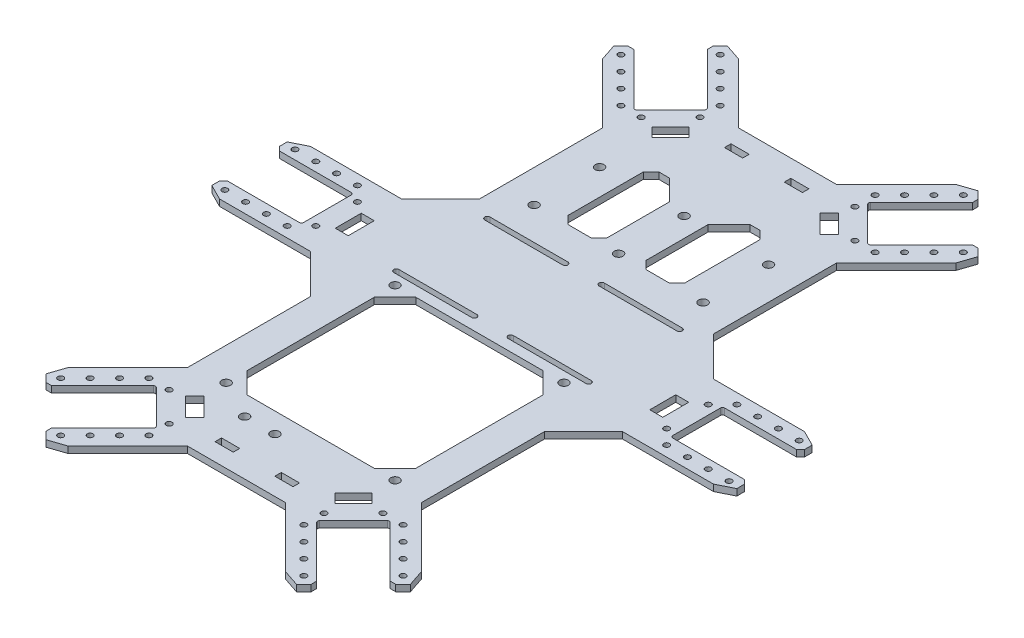
from build123d import *
from OCP.BRepFilletAPI import BRepFilletAPI_MakeChamfer

# Parameters (mm, degrees)
BOSS_EXTRU_1_DEPTH       = 2.5
ENL_V_MAT_EXTRU_1_REACH  = 191.513
ESQUISSE2_W              = 24.5
ESQUISSE2_H              = 20
ESQUISSE2_W_2            = 5.5
D_GAGEMENT_M21_D         = 2.2
SYM_TRIE4_OUTLINE_R      = 1.1
SYM_TRIE4_DEPTH          = 2.5
CHANFREIN1_SIZE          = 15
CHANFREIN3_SIZE          = 1.5
CHANFREIN4_SIZE          = 6
CHANFREIN4_SIZE2         = 3
CHANFREIN5_SIZE          = 3
CHANFREIN5_SIZE2         = 6
SYM_TRIE5_DEPTH          = 2.5
SYM_TRIE6_DEPTH          = 2.5
CONG_1_R                 = 0.8
ENL_V_MAT_EXTRU_2_REACH  = 167.515
ESQUISSE5_W              = 5
ESQUISSE5_H              = 10
ESQUISSE5_W_2            = 7
ESQUISSE5_H_2            = 2.5
M3_CLEARANCE_HOLE1_D     = 3.4
M3_CLEARANCE_HOLE1_DEPTH = 2.5
ENL_V_MAT_EXTRU_3_REACH  = 167.515


# Read off the part's stored shape, not the designer's step: Symétrie4, Symétrie5, Symétrie6
with BuildPart() as part:
    # Esquisse1 → Boss.-Extru.1 (new body)
    with BuildSketch(Plane(origin=(0, 0, 0), x_dir=(1, 0, 0), z_dir=(0, 1, 0))):
        Polygon((18.837049096, 106), (-18.837049096, 106), (-59.495863992, 146.658814896), (-85.658814896, 120.495863992), (-45, 79.837049096), (-45, 17.5), (-120, 17.5), (-120, -17.5), (-45, -17.5), (-45, -79.837049096), (-85.658814896, -120.495863992), (-59.495863992, -146.658814896), (-18.837049096, -106), (18.837049096, -106), (59.495863992, -146.658814896), (85.658814896, -120.495863992), (45, -79.837049096), (45, -17.5), (120, -17.5), (120, 17.5), (45, 17.5), (45, 79.837049096), (85.658814896, 120.495863992), (59.495863992, 146.658814896), align=None)
    extrude(amount=BOSS_EXTRU_1_DEPTH)

    # Esquisse2 → Enlèv. mat.-Extru.1 (cut, up to next)
    with BuildSketch(Plane(origin=(0, 2.5, 0), x_dir=(1, 0, 0), z_dir=(0, 1, 0)), mode=Mode.PRIVATE) as enl_v_mat_extru_1_sk1:
        Polygon((-48.182155493, 123.324291117), (-62.324291117, 109.182155493), (-45.000174977, 91.858039354), (-30.858039354, 106.000174977), align=None)
    enl_v_mat_extru_1_tool1 = extrude(enl_v_mat_extru_1_sk1.sketch, amount=-ENL_V_MAT_EXTRU_1_REACH, mode=Mode.PRIVATE) & part.part
    # Esquisse2 → Enlèv. mat.-Extru.1 (cut, up to next)
    with BuildSketch(Plane(origin=(0, 2.5, 0), x_dir=(1, 0, 0), z_dir=(0, 1, 0)), mode=Mode.PRIVATE) as enl_v_mat_extru_1_sk2:
        Polygon((-52.071242789, 127.213378413), (-66.213378413, 113.071242789), (-62.324291117, 109.182155493), (-48.182155493, 123.324291117), align=None)
    enl_v_mat_extru_1_tool2 = extrude(enl_v_mat_extru_1_sk2.sketch, amount=-ENL_V_MAT_EXTRU_1_REACH, mode=Mode.PRIVATE) & part.part
    # Esquisse2 → Enlèv. mat.-Extru.1 (cut, up to next)
    with BuildSketch(Plane(origin=(0, 2.5, 0), x_dir=(1, 0, 0), z_dir=(0, 1, 0)), mode=Mode.PRIVATE) as enl_v_mat_extru_1_sk3:
        Polygon((-52.071242789, 127.213378413), (-66.213378413, 113.071242789), (-62.324291117, 109.182155493), (-48.182155493, 123.324291117), align=None)
    enl_v_mat_extru_1_tool3 = extrude(enl_v_mat_extru_1_sk3.sketch, amount=-ENL_V_MAT_EXTRU_1_REACH, mode=Mode.PRIVATE) & part.part
    # Esquisse2 → Enlèv. mat.-Extru.1 (cut, up to next)
    with BuildSketch(Plane(origin=(0, 2.5, 0), x_dir=(1, 0, 0), z_dir=(0, 1, 0)), mode=Mode.PRIVATE) as enl_v_mat_extru_1_sk4:
        with Locations((-83.25, 0)):
            Rectangle(ESQUISSE2_W, ESQUISSE2_H)
    enl_v_mat_extru_1_tool4 = extrude(enl_v_mat_extru_1_sk4.sketch, amount=-ENL_V_MAT_EXTRU_1_REACH, mode=Mode.PRIVATE) & part.part
    # Esquisse2 → Enlèv. mat.-Extru.1 (cut, up to next)
    with BuildSketch(Plane(origin=(0, 2.5, 0), x_dir=(1, 0, 0), z_dir=(0, 1, 0)), mode=Mode.PRIVATE) as enl_v_mat_extru_1_sk5:
        with Locations((-98.25, 0)):
            Rectangle(ESQUISSE2_W_2, ESQUISSE2_H)
    enl_v_mat_extru_1_tool5 = extrude(enl_v_mat_extru_1_sk5.sketch, amount=-ENL_V_MAT_EXTRU_1_REACH, mode=Mode.PRIVATE) & part.part
    # Esquisse2 → Enlèv. mat.-Extru.1 (cut, up to next)
    with BuildSketch(Plane(origin=(0, 2.5, 0), x_dir=(1, 0, 0), z_dir=(0, 1, 0)), mode=Mode.PRIVATE) as enl_v_mat_extru_1_sk6:
        with Locations((-98.25, 0)):
            Rectangle(ESQUISSE2_W_2, ESQUISSE2_H)
    enl_v_mat_extru_1_tool6 = extrude(enl_v_mat_extru_1_sk6.sketch, amount=-ENL_V_MAT_EXTRU_1_REACH, mode=Mode.PRIVATE) & part.part
    # Esquisse2 → Enlèv. mat.-Extru.1 (cut, up to next)
    with BuildSketch(Plane(origin=(0, 2.5, 0), x_dir=(1, 0, 0), z_dir=(0, 1, 0)), mode=Mode.PRIVATE) as enl_v_mat_extru_1_sk7:
        with Locations((-98.25, 0)):
            Rectangle(ESQUISSE2_W_2, ESQUISSE2_H)
    enl_v_mat_extru_1_tool7 = extrude(enl_v_mat_extru_1_sk7.sketch, amount=-ENL_V_MAT_EXTRU_1_REACH, mode=Mode.PRIVATE) & part.part
    # Esquisse2 → Enlèv. mat.-Extru.1 (cut, up to next)
    with BuildSketch(Plane(origin=(0, 2.5, 0), x_dir=(1, 0, 0), z_dir=(0, 1, 0)), mode=Mode.PRIVATE) as enl_v_mat_extru_1_sk8:
        with Locations((-98.25, 0)):
            Rectangle(ESQUISSE2_W_2, ESQUISSE2_H)
    enl_v_mat_extru_1_tool8 = extrude(enl_v_mat_extru_1_sk8.sketch, amount=-ENL_V_MAT_EXTRU_1_REACH, mode=Mode.PRIVATE) & part.part
    # Esquisse2 → Enlèv. mat.-Extru.1 (cut, up to next)
    with BuildSketch(Plane(origin=(0, 2.5, 0), x_dir=(1, 0, 0), z_dir=(0, 1, 0)), mode=Mode.PRIVATE) as enl_v_mat_extru_1_sk9:
        Polygon((-52.071242789, 127.213378413), (-66.213378413, 113.071242789), (-62.324291117, 109.182155493), (-48.182155493, 123.324291117), align=None)
    enl_v_mat_extru_1_tool9 = extrude(enl_v_mat_extru_1_sk9.sketch, amount=-ENL_V_MAT_EXTRU_1_REACH, mode=Mode.PRIVATE) & part.part
    # Esquisse2 → Enlèv. mat.-Extru.1 (cut, up to next)
    with BuildSketch(Plane(origin=(0, 2.5, 0), x_dir=(1, 0, 0), z_dir=(0, 1, 0)), mode=Mode.PRIVATE) as enl_v_mat_extru_1_sk10:
        Polygon((-52.071242789, 127.213378413), (-66.213378413, 113.071242789), (-62.324291117, 109.182155493), (-48.182155493, 123.324291117), align=None)
    enl_v_mat_extru_1_tool10 = extrude(enl_v_mat_extru_1_sk10.sketch, amount=-ENL_V_MAT_EXTRU_1_REACH, mode=Mode.PRIVATE) & part.part
    # Esquisse2 → Enlèv. mat.-Extru.1 (cut, up to next)
    with BuildSketch(Plane(origin=(0, 2.5, 0), x_dir=(1, 0, 0), z_dir=(0, 1, 0)), mode=Mode.PRIVATE) as enl_v_mat_extru_1_sk11:
        Polygon((-101, -10), (-101, 10), (-101, 17.5), (-120, 17.5), (-120, -17.5), (-101, -17.5), align=None)
    enl_v_mat_extru_1_tool11 = extrude(enl_v_mat_extru_1_sk11.sketch, amount=-ENL_V_MAT_EXTRU_1_REACH, mode=Mode.PRIVATE) & part.part
    # Esquisse2 → Enlèv. mat.-Extru.1 (cut, up to next)
    with BuildSketch(Plane(origin=(0, 2.5, 0), x_dir=(1, 0, 0), z_dir=(0, 1, 0)), mode=Mode.PRIVATE) as enl_v_mat_extru_1_sk12:
        Polygon((-66.213378413, 113.071242789), (-52.071242789, 127.213378413), (-46.060835149, 133.223786053), (-59.495863992, 146.658814896), (-85.658814896, 120.495863992), (-72.223786053, 107.060835149), align=None)
    enl_v_mat_extru_1_tool12 = extrude(enl_v_mat_extru_1_sk12.sketch, amount=-ENL_V_MAT_EXTRU_1_REACH, mode=Mode.PRIVATE) & part.part
    enl_v_mat_extru_1_1 = enl_v_mat_extru_1_tool1.solids().sort_by_distance((-46.591165, 2.5, -107.591165))[0]
    add(enl_v_mat_extru_1_1, mode=Mode.SUBTRACT)
    enl_v_mat_extru_1_2 = enl_v_mat_extru_1_tool2.solids().sort_by_distance((-57.197767, 2.5, -118.197767))[0]
    add(enl_v_mat_extru_1_2, mode=Mode.SUBTRACT)
    enl_v_mat_extru_1_3 = enl_v_mat_extru_1_tool3.solids().sort_by_distance((-57.197767, 2.5, -118.197767))[0]
    add(enl_v_mat_extru_1_3, mode=Mode.SUBTRACT)
    enl_v_mat_extru_1_4 = enl_v_mat_extru_1_tool4.solids().sort_by_distance((-83.25, 2.5, 0))[0]
    add(enl_v_mat_extru_1_4, mode=Mode.SUBTRACT)
    enl_v_mat_extru_1_5 = enl_v_mat_extru_1_tool5.solids().sort_by_distance((-98.25, 2.5, 0))[0]
    add(enl_v_mat_extru_1_5, mode=Mode.SUBTRACT)
    enl_v_mat_extru_1_6 = enl_v_mat_extru_1_tool6.solids().sort_by_distance((-98.25, 2.5, 0))[0]
    add(enl_v_mat_extru_1_6, mode=Mode.SUBTRACT)
    enl_v_mat_extru_1_7 = enl_v_mat_extru_1_tool7.solids().sort_by_distance((-98.25, 2.5, 0))[0]
    add(enl_v_mat_extru_1_7, mode=Mode.SUBTRACT)
    enl_v_mat_extru_1_8 = enl_v_mat_extru_1_tool8.solids().sort_by_distance((-98.25, 2.5, 0))[0]
    add(enl_v_mat_extru_1_8, mode=Mode.SUBTRACT)
    enl_v_mat_extru_1_9 = enl_v_mat_extru_1_tool9.solids().sort_by_distance((-57.197767, 2.5, -118.197767))[0]
    add(enl_v_mat_extru_1_9, mode=Mode.SUBTRACT)
    enl_v_mat_extru_1_10 = enl_v_mat_extru_1_tool10.solids().sort_by_distance((-57.197767, 2.5, -118.197767))[0]
    add(enl_v_mat_extru_1_10, mode=Mode.SUBTRACT)
    enl_v_mat_extru_1_11 = enl_v_mat_extru_1_tool11.solids().sort_by_distance((-110.5, 2.5, 0))[0]
    add(enl_v_mat_extru_1_11, mode=Mode.SUBTRACT)
    enl_v_mat_extru_1_12 = enl_v_mat_extru_1_tool12.solids().sort_by_distance((-65.859825, 2.5, -126.859825))[0]
    add(enl_v_mat_extru_1_12, mode=Mode.SUBTRACT)
    enl_v_mat_extru_1 = enl_v_mat_extru_1_1 + enl_v_mat_extru_1_2 + enl_v_mat_extru_1_3 + enl_v_mat_extru_1_4 + enl_v_mat_extru_1_5 + enl_v_mat_extru_1_6 + enl_v_mat_extru_1_7 + enl_v_mat_extru_1_8 + enl_v_mat_extru_1_9 + enl_v_mat_extru_1_10 + enl_v_mat_extru_1_11 + enl_v_mat_extru_1_12  # Enlèv. mat.-Extru.1 as one shape, for the pattern or mirror that repeats it

    # Dégagement M21 (through all)
    with Locations(Plane(origin=(0, 2.5, 0), x_dir=(1, 0, 0), z_dir=(0, 1, 0))):
        with Locations((-67.5, -8), (-73, -13.5), (-81, -13.5), (-89, -13.5), (-97, -13.5), (-67.5, 8), (-73, 13.5), (-81, 13.5), (-89, 13.5), (-97, 13.5), (-41.111087681, 90.797379182), (-48.889262274, 90.797379182), (-54.546116524, 96.454233431), (-60.202970773, 102.111087681), (-65.859825023, 107.76794193), (-29.797379182, 102.111087681), (-29.797379182, 109.889262274), (-35.454233431, 115.546116524), (-41.111087681, 121.202970773), (-46.76794193, 126.859825023)):
            d_gagement_m21 = Hole(D_GAGEMENT_M21_D / 2)

    # Symétrie3: Enlèv. mat.-Extru.1, Dégagement M21 across plane
    add(enl_v_mat_extru_1.mirror(Plane(origin=(0, 0, 0), x_dir=(0, 0, 1), z_dir=(1, 0, 0))), mode=Mode.SUBTRACT)
    add(d_gagement_m21.mirror(Plane(origin=(0, 0, 0), x_dir=(0, 0, 1), z_dir=(1, 0, 0))), mode=Mode.SUBTRACT)

    # Symétrie4 outline → Symétrie4 (cut)
    with BuildSketch(Plane(origin=(0, 0, 0), x_dir=(1, 0, 0), z_dir=(0, 1, 0))):
        Polygon((30.858039354, -106.000174977), (52.071242789, -127.213378413), (46.060835149, -133.223786053), (59.495863992, -146.658814896), (85.658814896, -120.495863992), (72.223786053, -107.060835149), (66.213378413, -113.071242789), (45.000174977, -91.858039354), align=None)
        with Locations((46.76794193, -126.859825023)):
            Circle(SYM_TRIE4_OUTLINE_R)
        with Locations((41.111087681, -121.202970773)):
            Circle(SYM_TRIE4_OUTLINE_R)
        with Locations((35.454233431, -115.546116524)):
            Circle(SYM_TRIE4_OUTLINE_R)
        with Locations((29.797379182, -109.889262274)):
            Circle(SYM_TRIE4_OUTLINE_R)
        with Locations((29.797379182, -102.111087681)):
            Circle(SYM_TRIE4_OUTLINE_R)
        with Locations((65.859825023, -107.76794193)):
            Circle(SYM_TRIE4_OUTLINE_R)
        with Locations((60.202970773, -102.111087681)):
            Circle(SYM_TRIE4_OUTLINE_R)
        with Locations((54.546116524, -96.454233431)):
            Circle(SYM_TRIE4_OUTLINE_R)
        with Locations((48.889262274, -90.797379182)):
            Circle(SYM_TRIE4_OUTLINE_R)
        with Locations((41.111087681, -90.797379182)):
            Circle(SYM_TRIE4_OUTLINE_R)
        Polygon((-46.060835149, -133.223786053), (-52.071242789, -127.213378413), (-30.858039354, -106.000174977), (-45.000174977, -91.858039354), (-66.213378413, -113.071242789), (-72.223786053, -107.060835149), (-85.658814896, -120.495863992), (-59.495863992, -146.658814896), align=None)
        with Locations((-46.76794193, -126.859825023)):
            Circle(SYM_TRIE4_OUTLINE_R)
        with Locations((-41.111087681, -121.202970773)):
            Circle(SYM_TRIE4_OUTLINE_R)
        with Locations((-35.454233431, -115.546116524)):
            Circle(SYM_TRIE4_OUTLINE_R)
        with Locations((-29.797379182, -109.889262274)):
            Circle(SYM_TRIE4_OUTLINE_R)
        with Locations((-29.797379182, -102.111087681)):
            Circle(SYM_TRIE4_OUTLINE_R)
        with Locations((-65.859825023, -107.76794193)):
            Circle(SYM_TRIE4_OUTLINE_R)
        with Locations((-60.202970773, -102.111087681)):
            Circle(SYM_TRIE4_OUTLINE_R)
        with Locations((-54.546116524, -96.454233431)):
            Circle(SYM_TRIE4_OUTLINE_R)
        with Locations((-48.889262274, -90.797379182)):
            Circle(SYM_TRIE4_OUTLINE_R)
        with Locations((-41.111087681, -90.797379182)):
            Circle(SYM_TRIE4_OUTLINE_R)
    extrude(amount=SYM_TRIE4_DEPTH, mode=Mode.SUBTRACT)

    # Chanfrein1
    chanfrein1_edges = [part.edges().sort_by_distance(p)[0] for p in [
        (-45, 1.25, 17.5),
        (-45, 1.25, -17.5),
        (45, 1.25, -17.5),
        (45, 1.25, 17.5),
    ]]
    chamfer(chanfrein1_edges, length=CHANFREIN1_SIZE)

    # Chanfrein3
    chanfrein3_edges = [part.edges().sort_by_distance(p)[0] for p in [
        (-52.071242789, 1.25, -127.213378413),
        (-66.213378413, 1.25, -113.071242789),
        (-101, 1.25, 10),
        (-101, 1.25, -10),
    ]]
    chamfer(chanfrein3_edges, length=CHANFREIN3_SIZE)

    # Chanfrein4: one chamfer whose edges measure the first distance from different faces: ONE call of the kernel's chamfer builder (chamfer() names one face for all edges)
    chanfrein4_edges_1 = [part.edges().sort_by_distance(p)[0] for p in [
        (-72.223786053, 1.25, -107.060835149),
    ]]
    chanfrein4_side_1 = [part.faces().sort_by_distance(p)[0] for p in [
        (-58.611893027, 1.25, -93.448942123),
    ]]
    chanfrein4_edges_2 = [part.edges().sort_by_distance(p)[0] for p in [
        (-101, 1.25, 17.5),
    ]]
    chanfrein4_side_2 = [part.faces().sort_by_distance(p)[0] for p in [
        (-80.5, 1.25, 17.5),
    ]]
    chanfrein4 = BRepFilletAPI_MakeChamfer(part.part.solid().wrapped)
    for e in chanfrein4_edges_1:
        chanfrein4.Add(CHANFREIN4_SIZE, CHANFREIN4_SIZE2, e.wrapped, chanfrein4_side_1[0].wrapped)  # the first distance lies on this face
    for e in chanfrein4_edges_2:
        chanfrein4.Add(CHANFREIN4_SIZE, CHANFREIN4_SIZE2, e.wrapped, chanfrein4_side_2[0].wrapped)  # the first distance lies on this face
    add(Compound.cast(chanfrein4.Shape()), mode=Mode.REPLACE)

    # Chanfrein5: one chamfer whose edges measure the first distance from different faces: ONE call of the kernel's chamfer builder (chamfer() names one face for all edges)
    chanfrein5_edges_1 = [part.edges().sort_by_distance(p)[0] for p in [
        (-46.060835149, 1.25, -133.223786053),
    ]]
    chanfrein5_side_1 = [part.faces().sort_by_distance(p)[0] for p in [
        (-48.535708883, 1.25, -130.748912319),
    ]]
    chanfrein5_edges_2 = [part.edges().sort_by_distance(p)[0] for p in [
        (-101, 1.25, -17.5),
    ]]
    chanfrein5_side_2 = [part.faces().sort_by_distance(p)[0] for p in [
        (-101, 1.25, -14.5),
    ]]
    chanfrein5 = BRepFilletAPI_MakeChamfer(part.part.solid().wrapped)
    for e in chanfrein5_edges_1:
        chanfrein5.Add(CHANFREIN5_SIZE, CHANFREIN5_SIZE2, e.wrapped, chanfrein5_side_1[0].wrapped)  # the first distance lies on this face
    for e in chanfrein5_edges_2:
        chanfrein5.Add(CHANFREIN5_SIZE, CHANFREIN5_SIZE2, e.wrapped, chanfrein5_side_2[0].wrapped)  # the first distance lies on this face
    add(Compound.cast(chanfrein5.Shape()), mode=Mode.REPLACE)

    # Symétrie5 outline → Symétrie5 (cut)
    with BuildSketch(Plane(origin=(0, 0, 0), x_dir=(1, 0, 0), z_dir=(0, 1, 0))):
        Polygon((72.223786053, 107.060835149), (70.10246571, 109.182155492), (67.981145366, 102.818194462), align=None)
        Polygon((65.152718241, 112.010582618), (67.274038585, 112.010582618), (66.213378413, 113.071242789), align=None)
        Polygon((101, -10), (99.5, -10), (101, -11.5), align=None)
        Polygon((101, -17.5), (101, -14.5), (95, -17.5), align=None)
        Polygon((41.818194462, 128.981145366), (48.182155493, 131.10246571), (46.060835149, 133.223786053), align=None)
        Polygon((51.010582618, 128.274038585), (51.010582618, 126.152718241), (52.071242789, 127.213378413), align=None)
        Polygon((95, 17.5), (101, 14.5), (101, 17.5), align=None)
        Polygon((101, 11.5), (99.5, 10), (101, 10), align=None)
    extrude(amount=SYM_TRIE5_DEPTH, mode=Mode.SUBTRACT)

    # Symétrie6 outline → Symétrie6 (cut)
    with BuildSketch(Plane(origin=(0, 0, 0), x_dir=(1, 0, 0), z_dir=(0, 1, 0))):
        Polygon((-41.818194462, -128.981145366), (-48.182155493, -131.10246571), (-46.060835149, -133.223786053), align=None)
        Polygon((-51.010582618, -128.274038585), (-51.010582618, -126.152718241), (-52.071242789, -127.213378413), align=None)
        Polygon((51.010582618, -126.152718241), (51.010582618, -128.274038585), (52.071242789, -127.213378413), align=None)
        Polygon((46.060835149, -133.223786053), (48.182155493, -131.102465709), (41.818194462, -128.981145366), align=None)
        Polygon((-72.223786053, -107.060835149), (-70.10246571, -109.182155492), (-67.981145366, -102.818194462), align=None)
        Polygon((-65.152718241, -112.010582618), (-67.274038585, -112.010582618), (-66.213378413, -113.071242789), align=None)
        Polygon((67.981145366, -102.818194462), (70.10246571, -109.182155493), (72.223786053, -107.060835149), align=None)
        Polygon((67.274038585, -112.010582618), (65.152718241, -112.010582618), (66.213378413, -113.071242789), align=None)
    extrude(amount=SYM_TRIE6_DEPTH, mode=Mode.SUBTRACT)

    # Congé1
    cong_1_edges = [part.edges().sort_by_distance(p)[0] for p in [
        (-30.858039354, 1.25, -106.000174977),
        (-45.000174977, 1.25, -91.858039354),
        (71, 1.25, 10),
        (71, 1.25, -10),
        (30.858039354, 1.25, -106.000174977),
        (45.000174977, 1.25, -91.858039354),
        (30.858039354, 1.25, 106.000174977),
        (45.000174977, 1.25, 91.858039354),
        (-71, 1.25, -10),
        (-71, 1.25, 10),
        (-30.858039354, 1.25, 106.000174977),
        (-45.000174977, 1.25, 91.858039354),
    ]]
    fillet(cong_1_edges, radius=CONG_1_R)

    # Esquisse5 → Enlèv. mat.-Extru.2 (cut, up to next)
    with BuildSketch(Plane(origin=(0, 2.5, 0), x_dir=(1, 0, 0), z_dir=(0, 1, 0)), mode=Mode.PRIVATE) as enl_v_mat_extru_2_sk1:
        Polygon((-22.5, 73), (-19.5, 76), (-15.5, 76), (-7.5, 68), (-7.5, 44), (-10.5, 41), (-19.5, 41), (-22.5, 44), align=None)
    enl_v_mat_extru_2_tool1 = extrude(enl_v_mat_extru_2_sk1.sketch, amount=-ENL_V_MAT_EXTRU_2_REACH, mode=Mode.PRIVATE) & part.part
    # Esquisse5 → Enlèv. mat.-Extru.2 (cut, up to next)
    with BuildSketch(Plane(origin=(0, 2.5, 0), x_dir=(1, 0, 0), z_dir=(0, 1, 0)), mode=Mode.PRIVATE) as enl_v_mat_extru_2_sk2:
        Polygon((22.5, 73), (19.5, 76), (15.5, 76), (7.5, 68), (7.5, 44), (10.5, 41), (19.5, 41), (22.5, 44), align=None)
    enl_v_mat_extru_2_tool2 = extrude(enl_v_mat_extru_2_sk2.sketch, amount=-ENL_V_MAT_EXTRU_2_REACH, mode=Mode.PRIVATE) & part.part
    # Esquisse5 → Enlèv. mat.-Extru.2 (cut, up to next)
    with BuildSketch(Plane(origin=(0, 2.5, 0), x_dir=(1, 0, 0), z_dir=(0, 1, 0)), mode=Mode.PRIVATE) as enl_v_mat_extru_2_sk3:
        Polygon((32.5, -69.5), (24.5, -77.5), (-24.5, -77.5), (-32.5, -69.5), (-32.5, -20.5), (-24.5, -12.5), (24.5, -12.5), (32.5, -20.5), align=None)
        Polygon((-19.5, -76), (-15.5, -76), (-7.5, -68), (-7.5, -44), (-10.5, -41), (-19.5, -41), (-22.5, -44), (-22.5, -73), align=None, mode=Mode.SUBTRACT)
        Polygon((22.5, -73), (22.5, -44), (19.5, -41), (10.5, -41), (7.5, -44), (7.5, -68), (15.5, -76), (19.5, -76), align=None, mode=Mode.SUBTRACT)
    enl_v_mat_extru_2_tool3 = extrude(enl_v_mat_extru_2_sk3.sketch, amount=-ENL_V_MAT_EXTRU_2_REACH, mode=Mode.PRIVATE) & part.part
    # Esquisse5 → Enlèv. mat.-Extru.2 (cut, up to next)
    with BuildSketch(Plane(origin=(0, 2.5, 0), x_dir=(1, 0, 0), z_dir=(0, 1, 0)), mode=Mode.PRIVATE) as enl_v_mat_extru_2_sk4:
        Polygon((-22.5, -73), (-19.5, -76), (-15.5, -76), (-7.5, -68), (-7.5, -44), (-10.5, -41), (-19.5, -41), (-22.5, -44), align=None)
    enl_v_mat_extru_2_tool4 = extrude(enl_v_mat_extru_2_sk4.sketch, amount=-ENL_V_MAT_EXTRU_2_REACH, mode=Mode.PRIVATE) & part.part
    # Esquisse5 → Enlèv. mat.-Extru.2 (cut, up to next)
    with BuildSketch(Plane(origin=(0, 2.5, 0), x_dir=(1, 0, 0), z_dir=(0, 1, 0)), mode=Mode.PRIVATE) as enl_v_mat_extru_2_sk5:
        Polygon((22.5, -73), (19.5, -76), (15.5, -76), (7.5, -68), (7.5, -44), (10.5, -41), (19.5, -41), (22.5, -44), align=None)
    enl_v_mat_extru_2_tool5 = extrude(enl_v_mat_extru_2_sk5.sketch, amount=-ENL_V_MAT_EXTRU_2_REACH, mode=Mode.PRIVATE) & part.part
    # Esquisse5 → Enlèv. mat.-Extru.2 (cut, up to next)
    with BuildSketch(Plane(origin=(0, 2.5, 0), x_dir=(1, 0, 0), z_dir=(0, 1, 0)), mode=Mode.PRIVATE) as enl_v_mat_extru_2_sk6:
        with Locations((-60.5, 0)):
            Rectangle(ESQUISSE5_W, ESQUISSE5_H)
    enl_v_mat_extru_2_tool6 = extrude(enl_v_mat_extru_2_sk6.sketch, amount=-ENL_V_MAT_EXTRU_2_REACH, mode=Mode.PRIVATE) & part.part
    # Esquisse5 → Enlèv. mat.-Extru.2 (cut, up to next)
    with BuildSketch(Plane(origin=(0, 2.5, 0), x_dir=(1, 0, 0), z_dir=(0, 1, 0)), mode=Mode.PRIVATE) as enl_v_mat_extru_2_sk7:
        with Locations((60.5, 0)):
            Rectangle(ESQUISSE5_W, ESQUISSE5_H)
    enl_v_mat_extru_2_tool7 = extrude(enl_v_mat_extru_2_sk7.sketch, amount=-ENL_V_MAT_EXTRU_2_REACH, mode=Mode.PRIVATE) & part.part
    # Esquisse5 → Enlèv. mat.-Extru.2 (cut, up to next)
    with BuildSketch(Plane(origin=(0, 2.5, 0), x_dir=(1, 0, 0), z_dir=(0, 1, 0)), mode=Mode.PRIVATE) as enl_v_mat_extru_2_sk8:
        Polygon((-32.272252916, -86.201185104), (-35.807786822, -89.73671901), (-28.73671901, -96.807786822), (-25.201185104, -93.272252916), align=None)
    enl_v_mat_extru_2_tool8 = extrude(enl_v_mat_extru_2_sk8.sketch, amount=-ENL_V_MAT_EXTRU_2_REACH, mode=Mode.PRIVATE) & part.part
    # Esquisse5 → Enlèv. mat.-Extru.2 (cut, up to next)
    with BuildSketch(Plane(origin=(0, 2.5, 0), x_dir=(1, 0, 0), z_dir=(0, 1, 0)), mode=Mode.PRIVATE) as enl_v_mat_extru_2_sk9:
        Polygon((32.272252916, -86.201185104), (35.807786822, -89.73671901), (28.73671901, -96.807786822), (25.201185104, -93.272252916), align=None)
    enl_v_mat_extru_2_tool9 = extrude(enl_v_mat_extru_2_sk9.sketch, amount=-ENL_V_MAT_EXTRU_2_REACH, mode=Mode.PRIVATE) & part.part
    # Esquisse5 → Enlèv. mat.-Extru.2 (cut, up to next)
    with BuildSketch(Plane(origin=(0, 2.5, 0), x_dir=(1, 0, 0), z_dir=(0, 1, 0)), mode=Mode.PRIVATE) as enl_v_mat_extru_2_sk10:
        with Locations((11.5, -98)):
            Rectangle(ESQUISSE5_W_2, ESQUISSE5_H_2)
    enl_v_mat_extru_2_tool10 = extrude(enl_v_mat_extru_2_sk10.sketch, amount=-ENL_V_MAT_EXTRU_2_REACH, mode=Mode.PRIVATE) & part.part
    # Esquisse5 → Enlèv. mat.-Extru.2 (cut, up to next)
    with BuildSketch(Plane(origin=(0, 2.5, 0), x_dir=(1, 0, 0), z_dir=(0, 1, 0)), mode=Mode.PRIVATE) as enl_v_mat_extru_2_sk11:
        with Locations((-11.5, -98)):
            Rectangle(ESQUISSE5_W_2, ESQUISSE5_H_2)
    enl_v_mat_extru_2_tool11 = extrude(enl_v_mat_extru_2_sk11.sketch, amount=-ENL_V_MAT_EXTRU_2_REACH, mode=Mode.PRIVATE) & part.part
    # Esquisse5 → Enlèv. mat.-Extru.2 (cut, up to next)
    with BuildSketch(Plane(origin=(0, 2.5, 0), x_dir=(1, 0, 0), z_dir=(0, 1, 0)), mode=Mode.PRIVATE) as enl_v_mat_extru_2_sk12:
        with Locations((-11.5, 98)):
            Rectangle(ESQUISSE5_W_2, ESQUISSE5_H_2)
    enl_v_mat_extru_2_tool12 = extrude(enl_v_mat_extru_2_sk12.sketch, amount=-ENL_V_MAT_EXTRU_2_REACH, mode=Mode.PRIVATE) & part.part
    # Esquisse5 → Enlèv. mat.-Extru.2 (cut, up to next)
    with BuildSketch(Plane(origin=(0, 2.5, 0), x_dir=(1, 0, 0), z_dir=(0, 1, 0)), mode=Mode.PRIVATE) as enl_v_mat_extru_2_sk13:
        with Locations((11.5, 98)):
            Rectangle(ESQUISSE5_W_2, ESQUISSE5_H_2)
    enl_v_mat_extru_2_tool13 = extrude(enl_v_mat_extru_2_sk13.sketch, amount=-ENL_V_MAT_EXTRU_2_REACH, mode=Mode.PRIVATE) & part.part
    # Esquisse5 → Enlèv. mat.-Extru.2 (cut, up to next)
    with BuildSketch(Plane(origin=(0, 2.5, 0), x_dir=(1, 0, 0), z_dir=(0, 1, 0)), mode=Mode.PRIVATE) as enl_v_mat_extru_2_sk14:
        Polygon((32.272252916, 86.201185104), (35.807786822, 89.73671901), (28.73671901, 96.807786822), (25.201185104, 93.272252916), align=None)
    enl_v_mat_extru_2_tool14 = extrude(enl_v_mat_extru_2_sk14.sketch, amount=-ENL_V_MAT_EXTRU_2_REACH, mode=Mode.PRIVATE) & part.part
    # Esquisse5 → Enlèv. mat.-Extru.2 (cut, up to next)
    with BuildSketch(Plane(origin=(0, 2.5, 0), x_dir=(1, 0, 0), z_dir=(0, 1, 0)), mode=Mode.PRIVATE) as enl_v_mat_extru_2_sk15:
        Polygon((-32.272252916, 86.201185104), (-25.201185104, 93.272252916), (-28.73671901, 96.807786822), (-35.807786822, 89.73671901), align=None)
    enl_v_mat_extru_2_tool15 = extrude(enl_v_mat_extru_2_sk15.sketch, amount=-ENL_V_MAT_EXTRU_2_REACH, mode=Mode.PRIVATE) & part.part
    add(enl_v_mat_extru_2_tool1.solids().sort_by_distance((-15.261557, 2.5, -57.664929))[0], mode=Mode.SUBTRACT)
    add(enl_v_mat_extru_2_tool2.solids().sort_by_distance((15.261557, 2.5, -57.664929))[0], mode=Mode.SUBTRACT)
    add(enl_v_mat_extru_2_tool3.solids().sort_by_distance((0, 2.5, 41.129488))[0], mode=Mode.SUBTRACT)
    add(enl_v_mat_extru_2_tool4.solids().sort_by_distance((-15.261557, 2.5, 57.664929))[0], mode=Mode.SUBTRACT)
    add(enl_v_mat_extru_2_tool5.solids().sort_by_distance((15.261557, 2.5, 57.664929))[0], mode=Mode.SUBTRACT)
    add(enl_v_mat_extru_2_tool6.solids().sort_by_distance((-60.5, 2.5, 0))[0], mode=Mode.SUBTRACT)
    add(enl_v_mat_extru_2_tool7.solids().sort_by_distance((60.5, 2.5, 0))[0], mode=Mode.SUBTRACT)
    add(enl_v_mat_extru_2_tool8.solids().sort_by_distance((-30.504486, 2.5, 91.504486))[0], mode=Mode.SUBTRACT)
    add(enl_v_mat_extru_2_tool9.solids().sort_by_distance((30.504486, 2.5, 91.504486))[0], mode=Mode.SUBTRACT)
    add(enl_v_mat_extru_2_tool10.solids().sort_by_distance((11.5, 2.5, 98))[0], mode=Mode.SUBTRACT)
    add(enl_v_mat_extru_2_tool11.solids().sort_by_distance((-11.5, 2.5, 98))[0], mode=Mode.SUBTRACT)
    add(enl_v_mat_extru_2_tool12.solids().sort_by_distance((-11.5, 2.5, -98))[0], mode=Mode.SUBTRACT)
    add(enl_v_mat_extru_2_tool13.solids().sort_by_distance((11.5, 2.5, -98))[0], mode=Mode.SUBTRACT)
    add(enl_v_mat_extru_2_tool14.solids().sort_by_distance((30.504486, 2.5, -91.504486))[0], mode=Mode.SUBTRACT)
    add(enl_v_mat_extru_2_tool15.solids().sort_by_distance((-30.504486, 2.5, -91.504486))[0], mode=Mode.SUBTRACT)

    # M3 Clearance Hole1
    with Locations(Plane(origin=(0, 2.5, 0), x_dir=(1, 0, 0), z_dir=(0, 1, 0))):
        with Locations((32.5, -77.5), (-32.5, -77.5), (-32.5, -12.5), (32.5, -12.5), (0, 41), (-32.5, 41), (32.5, 41), (0, 66.189989373), (32.5, 66.189989373), (-32.5, 66.189989373), (84.288057425, 68.310152458), (-17.653852265, -85.203550031), (-6.019165136, -85.203550031)):
            Hole(M3_CLEARANCE_HOLE1_D / 2, depth=M3_CLEARANCE_HOLE1_DEPTH)

    # Esquisse9 → Enlèv. mat.-Extru.3 (cut, up to next)
    with BuildSketch(Plane(origin=(0, 2.5, 0), x_dir=(1, 0, 0), z_dir=(0, 1, 0)), mode=Mode.PRIVATE) as enl_v_mat_extru_3_sk1:
        with BuildLine():
            Line((-37, -6.5), (-7, -6.5))
            ThreePointArc((-7, -6.5), (-6, -7.5), (-7, -8.5))
            Line((-7, -8.5), (-37, -8.5))
            ThreePointArc((-37, -8.5), (-38, -7.5), (-37, -6.5))
        make_face()
    enl_v_mat_extru_3_tool1 = extrude(enl_v_mat_extru_3_sk1.sketch, amount=-ENL_V_MAT_EXTRU_3_REACH, mode=Mode.PRIVATE) & part.part
    # Esquisse9 → Enlèv. mat.-Extru.3 (cut, up to next)
    with BuildSketch(Plane(origin=(0, 2.5, 0), x_dir=(1, 0, 0), z_dir=(0, 1, 0)), mode=Mode.PRIVATE) as enl_v_mat_extru_3_sk2:
        with BuildLine():
            Line((-37, 28.5), (-7, 28.5))
            ThreePointArc((-7, 28.5), (-6, 27.5), (-7, 26.5))
            Line((-7, 26.5), (-37, 26.5))
            ThreePointArc((-37, 26.5), (-38, 27.5), (-37, 28.5))
        make_face()
    enl_v_mat_extru_3_tool2 = extrude(enl_v_mat_extru_3_sk2.sketch, amount=-ENL_V_MAT_EXTRU_3_REACH, mode=Mode.PRIVATE) & part.part
    # Esquisse9 → Enlèv. mat.-Extru.3 (cut, up to next)
    with BuildSketch(Plane(origin=(0, 2.5, 0), x_dir=(1, 0, 0), z_dir=(0, 1, 0)), mode=Mode.PRIVATE) as enl_v_mat_extru_3_sk3:
        with BuildLine():
            Line((37, -6.5), (7, -6.5))
            ThreePointArc((7, -6.5), (6, -7.5), (7, -8.5))
            Line((7, -8.5), (37, -8.5))
            ThreePointArc((37, -8.5), (38, -7.5), (37, -6.5))
        make_face()
    enl_v_mat_extru_3_tool3 = extrude(enl_v_mat_extru_3_sk3.sketch, amount=-ENL_V_MAT_EXTRU_3_REACH, mode=Mode.PRIVATE) & part.part
    # Esquisse9 → Enlèv. mat.-Extru.3 (cut, up to next)
    with BuildSketch(Plane(origin=(0, 2.5, 0), x_dir=(1, 0, 0), z_dir=(0, 1, 0)), mode=Mode.PRIVATE) as enl_v_mat_extru_3_sk4:
        with BuildLine():
            Line((37, 28.5), (7, 28.5))
            ThreePointArc((7, 28.5), (6, 27.5), (7, 26.5))
            Line((7, 26.5), (37, 26.5))
            ThreePointArc((37, 26.5), (38, 27.5), (37, 28.5))
        make_face()
    enl_v_mat_extru_3_tool4 = extrude(enl_v_mat_extru_3_sk4.sketch, amount=-ENL_V_MAT_EXTRU_3_REACH, mode=Mode.PRIVATE) & part.part
    add(enl_v_mat_extru_3_tool1.solids().sort_by_distance((-22, 2.5, 7.5))[0], mode=Mode.SUBTRACT)
    add(enl_v_mat_extru_3_tool2.solids().sort_by_distance((-22, 2.5, -27.5))[0], mode=Mode.SUBTRACT)
    add(enl_v_mat_extru_3_tool3.solids().sort_by_distance((22, 2.5, 7.5))[0], mode=Mode.SUBTRACT)
    add(enl_v_mat_extru_3_tool4.solids().sort_by_distance((22, 2.5, -27.5))[0], mode=Mode.SUBTRACT)


solid = part.part
